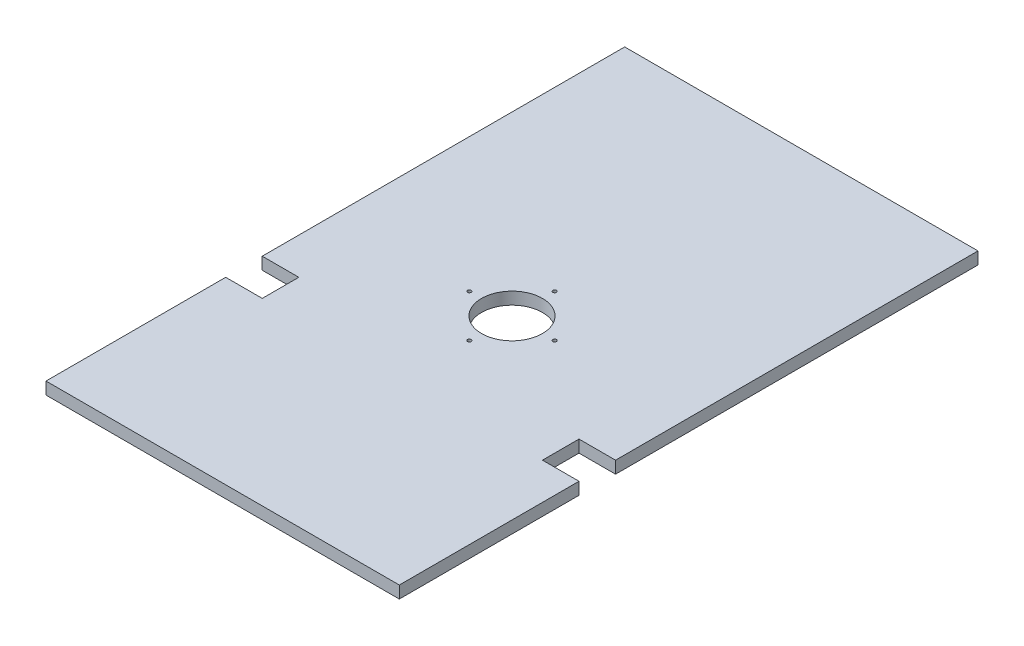
from build123d import *

# Parameters (mm, degrees)
CROQUIS1_R              = 1.5
SALIENTE_EXTRUIR2_DEPTH = 10
CROQUIS3_R              = 25
CORTAR_EXTRUIR1_DEPTH   = 10


with BuildPart() as part:
    # Croquis1 → Saliente-Extruir2 (new body)
    with BuildSketch(Plane(origin=(0, 0, 0), x_dir=(1, 0, 0), z_dir=(0, 1, 0))):
        Polygon((-145, 237.5), (145, 237.5), (145, -60), (115, -60), (115, -90), (145, -90), (145, -237.5), (-145, -237.5), (-145, -90), (-115, -90), (-115, -60), (-145, -60), align=None)
        with Locations((0, 35)):
            Circle(CROQUIS1_R, mode=Mode.SUBTRACT)
        with Locations((-35, 0)):
            Circle(CROQUIS1_R, mode=Mode.SUBTRACT)
        with Locations((0, -35)):
            Circle(CROQUIS1_R, mode=Mode.SUBTRACT)
        with Locations((35, 0)):
            Circle(CROQUIS1_R, mode=Mode.SUBTRACT)
    extrude(amount=SALIENTE_EXTRUIR2_DEPTH)

    # Croquis3 → Cortar-Extruir1 (cut, symmetric)
    with BuildSketch(Plane(origin=(0, 0, 0), x_dir=(1, 0, 0), z_dir=(0, 1, 0))):
        Circle(CROQUIS3_R)
    extrude(amount=CORTAR_EXTRUIR1_DEPTH, both=True, mode=Mode.SUBTRACT)


solid = part.part
